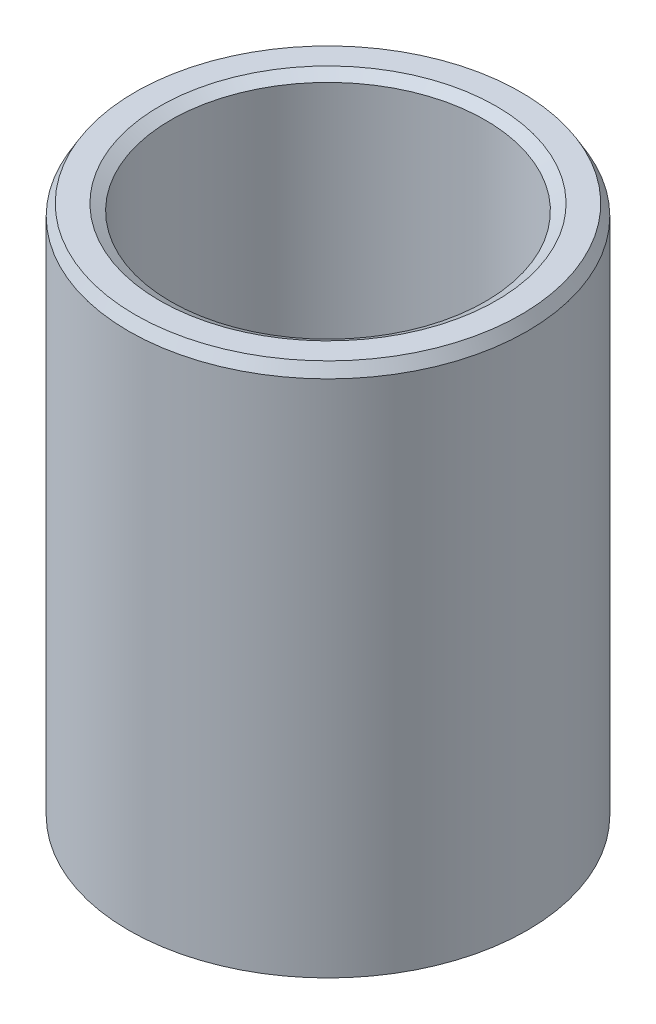
from build123d import *
from OCP.BRepFilletAPI import BRepFilletAPI_MakeChamfer

# Parameters (mm, degrees)
SKETCH1_R           = 47.5
BOSS_EXTRUDE1_DEPTH = 127.836191745
SKETCH2_R           = 37.49024639
CUT_EXTRUDE1_DEPTH  = 145.411190424
CHAMFER1_SIZE       = 2.641604051
CHAMFER1_SIZE2      = 1.52513081


with BuildPart() as part:
    # Sketch1 → Boss-Extrude1 (new body)
    with BuildSketch(Plane(origin=(0, 0, 0), x_dir=(1, 0, 0), z_dir=(0, 1, 0))):
        Circle(SKETCH1_R)
    extrude(amount=BOSS_EXTRUDE1_DEPTH)

    # Sketch2 → Cut-Extrude1 (cut, through all)
    with BuildSketch(Plane(origin=(0, 0, 0), x_dir=(1, 0, 0), z_dir=(0, 1, 0))):
        Circle(SKETCH2_R)
    extrude(amount=CUT_EXTRUDE1_DEPTH, mode=Mode.SUBTRACT)

    # Chamfer1: one chamfer whose edges measure the first distance from different faces: ONE call of the kernel's chamfer builder (chamfer() names one face for all edges)
    chamfer1_edges_1 = [part.edges().sort_by_distance(p)[0] for p in [
        (-37.49024639, 127.836191745, 0),
    ]]
    chamfer1_side_1 = [part.faces().sort_by_distance(p)[0] for p in [
        (-46.156497116, 127.836191745, 0),
    ]]
    chamfer1_edges_2 = [part.edges().sort_by_distance(p)[0] for p in [
        (-37.49024639, 0, 0),
    ]]
    chamfer1_side_2 = [part.faces().sort_by_distance(p)[0] for p in [
        (-37.49024639, 63.918095872, 0),
    ]]
    chamfer1_edges_3 = [part.edges().sort_by_distance(p)[0] for p in [
        (-47.5, 0, 0),
    ]]
    chamfer1_side_3 = [part.faces().sort_by_distance(p)[0] for p in [
        (-46.156497116, 0, 0),
    ]]
    chamfer1_edges_4 = [part.edges().sort_by_distance(p)[0] for p in [
        (-47.5, 127.836191745, 0),
    ]]
    chamfer1_side_4 = [part.faces().sort_by_distance(p)[0] for p in [
        (-47.5, 63.918095872, 0),
    ]]
    chamfer1 = BRepFilletAPI_MakeChamfer(part.part.solid().wrapped)
    for e in chamfer1_edges_1:
        chamfer1.Add(CHAMFER1_SIZE, CHAMFER1_SIZE2, e.wrapped, chamfer1_side_1[0].wrapped)  # the first distance lies on this face
    for e in chamfer1_edges_2:
        chamfer1.Add(CHAMFER1_SIZE, CHAMFER1_SIZE2, e.wrapped, chamfer1_side_2[0].wrapped)  # the first distance lies on this face
    for e in chamfer1_edges_3:
        chamfer1.Add(CHAMFER1_SIZE, CHAMFER1_SIZE2, e.wrapped, chamfer1_side_3[0].wrapped)  # the first distance lies on this face
    for e in chamfer1_edges_4:
        chamfer1.Add(CHAMFER1_SIZE, CHAMFER1_SIZE2, e.wrapped, chamfer1_side_4[0].wrapped)  # the first distance lies on this face
    add(Compound.cast(chamfer1.Shape()), mode=Mode.REPLACE)


solid = part.part
